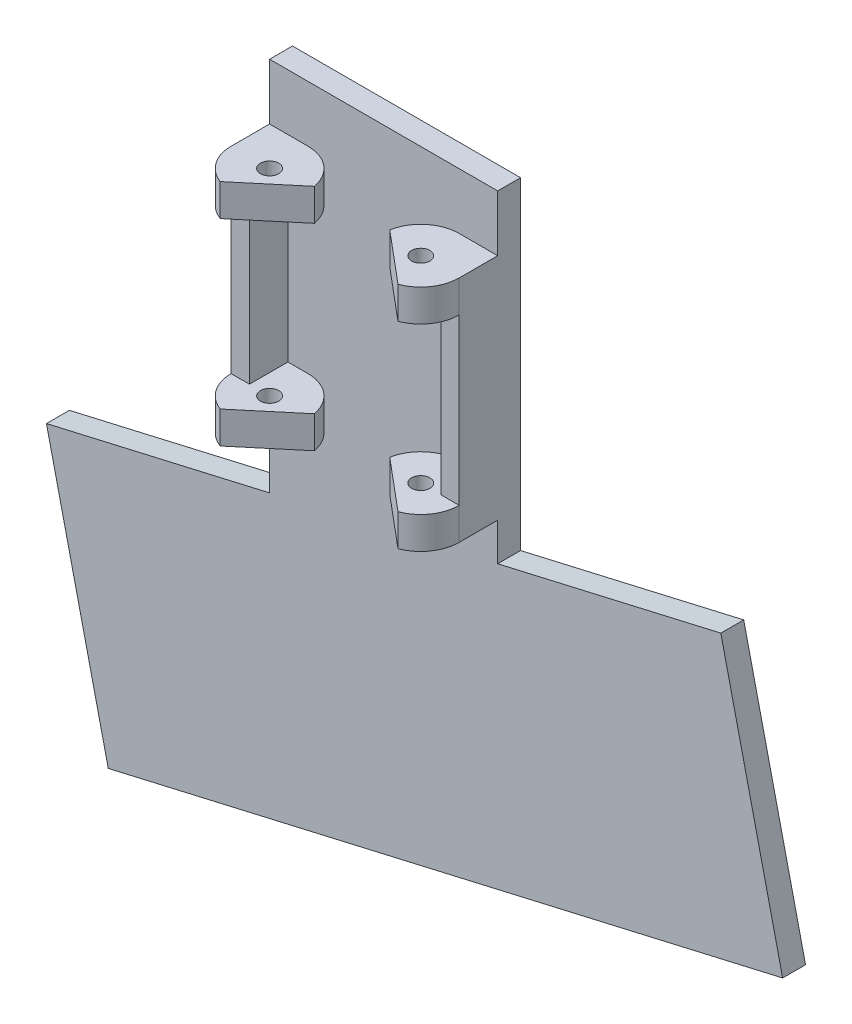
from build123d import *

# Parameters (mm, degrees)
BOSS_EXTRUDE2_DEPTH     = 7
CUT_EXTRUDE2_DEPTH      = 30.130224853
CUT_EXTRUDE2_DEPTH_BACK = 30.130224853
SKETCH3_R               = 2
BOSS_EXTRUDE3_DEPTH     = 36
SKETCH5_R               = 2
BOSS_EXTRUDE4_DEPTH     = 7
SKETCH13_W              = 49.8
SKETCH13_H              = 5
BOSS_EXTRUDE6_DEPTH     = 12.25
SKETCH15_W              = 49.8
SKETCH15_H              = 5
BOSS_EXTRUDE7_DEPTH     = 8.25
BOSS_EXTRUDE8_DEPTH     = 5


with BuildPart() as part:
    # Sketch1 → Boss-Extrude2 (new body)
    with BuildSketch(Plane(origin=(0, 0, 0), x_dir=(1, 0, 0), z_dir=(0, 1, 0))):
        with BuildLine():
            Line((-24.9, 0), (-24.9, 13.4))
            Line((-24.9, 13.4), (24.9, 13.4))
            Line((24.9, 13.4), (24.9, 0))
            ThreePointArc((24.9, 0), (23.392904185, -4.800819919), (19.412411454, -7.878950407))
            Line((19.412411454, -7.878950407), (8.235013612, 1.5))
            ThreePointArc((8.235013612, 1.5), (11.116692467, 6.448255578), (16.5, 8.4))
            Line((16.5, 8.4), (-16.5, 8.4))
            ThreePointArc((-16.5, 8.4), (-11.116692467, 6.448255578), (-8.235013612, 1.5))
            Line((-8.235013612, 1.5), (-19.412411454, -7.878950407))
            ThreePointArc((-19.412411454, -7.878950407), (-23.392904185, -4.800819919), (-24.9, 0))
        make_face()
    extrude(amount=BOSS_EXTRUDE2_DEPTH)

    # Sketch3 → Cut-Extrude2 (cut, two sides: drawn at the far end of the back side and taken through both)
    with BuildSketch(Plane(origin=(0, 7, 0), x_dir=(1, 0, 0), z_dir=(0, 1, 0)).offset(-CUT_EXTRUDE2_DEPTH_BACK)):
        with Locations((-16.5, 0)):
            Circle(SKETCH3_R)
        with Locations((16.5, 0)):
            Circle(SKETCH3_R)
    extrude(amount=CUT_EXTRUDE2_DEPTH + CUT_EXTRUDE2_DEPTH_BACK, mode=Mode.SUBTRACT)

    # Sketch4 → Boss-Extrude3 (add)
    with BuildSketch(Plane(origin=(0, 7, 0), x_dir=(1, 0, 0), z_dir=(0, 1, 0))):
        Polygon((-24.9, 13.4), (-24.9, 0), (-20.9, 0), (-20.9, 8.4), (-16.5, 8.4), (16.5, 8.4), (20.9, 8.4), (20.9, 0), (24.9, 0), (24.9, 13.4), align=None)
    extrude(amount=BOSS_EXTRUDE3_DEPTH)

    # Sketch5 → Boss-Extrude4 (add)
    with BuildSketch(Plane(origin=(0, 43, 0), x_dir=(1, 0, 0), z_dir=(0, 1, 0))):
        with BuildLine():
            Line((-24.9, 13.4), (-24.9, 0))
            ThreePointArc((-24.9, 0), (-23.392904185, -4.800819919), (-19.412411454, -7.878950407))
            Line((-19.412411454, -7.878950407), (-8.235013612, 1.5))
            ThreePointArc((-8.235013612, 1.5), (-11.116692467, 6.448255578), (-16.5, 8.4))
            Line((-16.5, 8.4), (16.5, 8.4))
            ThreePointArc((16.5, 8.4), (11.116692467, 6.448255578), (8.235013612, 1.5))
            Line((8.235013612, 1.5), (19.412411454, -7.878950407))
            ThreePointArc((19.412411454, -7.878950407), (23.392904185, -4.800819919), (24.9, 0))
            Line((24.9, 0), (24.9, 13.4))
            Line((24.9, 13.4), (-24.9, 13.4))
        make_face()
        with Locations((16.5, 0)):
            Circle(SKETCH5_R, mode=Mode.SUBTRACT)
        with Locations((-16.5, 0)):
            Circle(SKETCH5_R, mode=Mode.SUBTRACT)
    extrude(amount=BOSS_EXTRUDE4_DEPTH)

    # Sketch13 → Boss-Extrude6 (add)
    with BuildSketch(Plane(origin=(0, 50, 0), x_dir=(1, 0, 0), z_dir=(0, 1, 0))):
        with Locations((0, 10.9)):
            Rectangle(SKETCH13_W, SKETCH13_H)
    extrude(amount=BOSS_EXTRUDE6_DEPTH)

    # Sketch15 → Boss-Extrude7 (add)
    with BuildSketch(Plane.XZ):
        with Locations((0, -10.9)):
            Rectangle(SKETCH15_W, SKETCH15_H)
    extrude(amount=BOSS_EXTRUDE7_DEPTH)

    # Sketch12 → Boss-Extrude8 (add)
    with BuildSketch(Plane(origin=(0, 0, -13.4), x_dir=(-1, 0, 0), z_dir=(0, 0, -1))):
        Polygon((24.9, -8.25), (24.9, -19.747235918), (73.618503239, -30.994788635), (60.121439979, -89.456992522), (-87.1155665, -55.46465117), (-73.618503239, 2.997552717), (-24.9, -8.25), align=None)
    extrude(amount=-BOSS_EXTRUDE8_DEPTH)


solid = part.part
